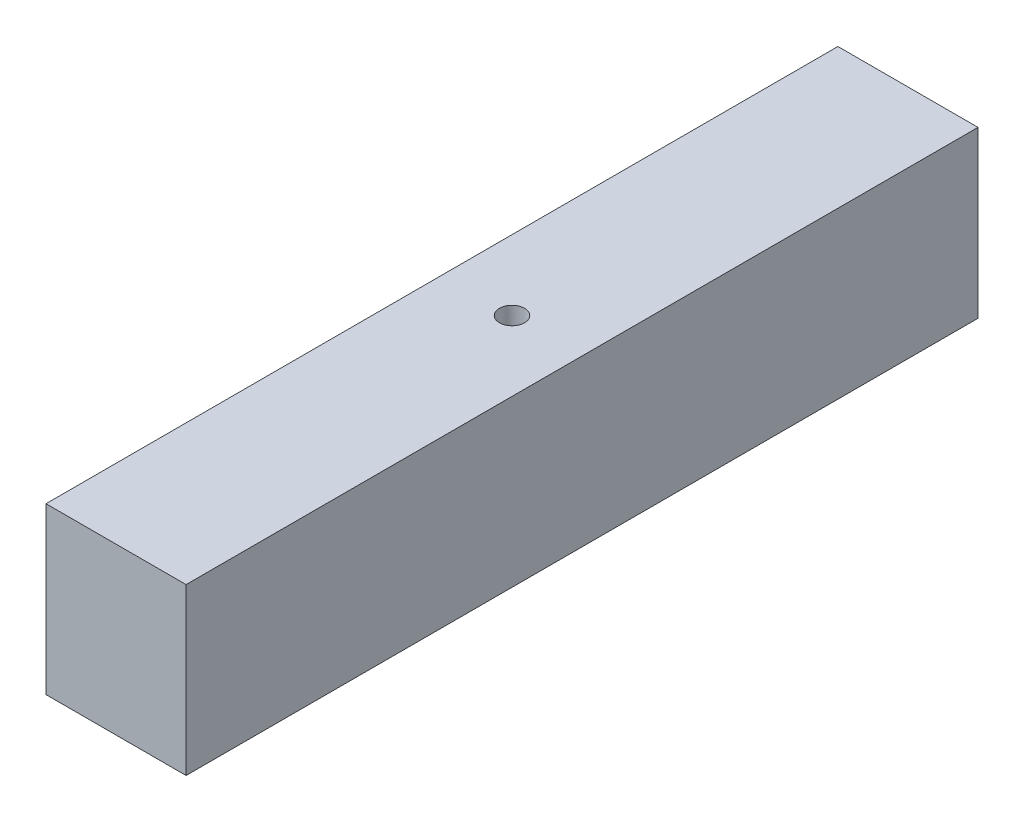
from build123d import *

# Parameters (mm, degrees)
SKETCH1_W           = 17.69
SKETCH1_H           = 20.88
BOSS_EXTRUDE1_DEPTH = 100
SKETCH2_R           = 1.5875
CUT_EXTRUDE1_DEPTH  = 106.78


with BuildPart() as part:
    # Sketch1 → Boss-Extrude1 (new body)
    with BuildSketch(Plane.XY):
        with Locations((8.845, 10.44)):
            Rectangle(SKETCH1_W, SKETCH1_H)
    extrude(amount=BOSS_EXTRUDE1_DEPTH)

    # Sketch2 → Cut-Extrude1 (cut)
    with BuildSketch(Plane(origin=(0, 20.88, 0), x_dir=(1, 0, 0), z_dir=(0, 1, 0))):
        with Locations((8.845, -50)):
            Circle(SKETCH2_R)
    extrude(amount=-CUT_EXTRUDE1_DEPTH, mode=Mode.SUBTRACT)


solid = part.part
